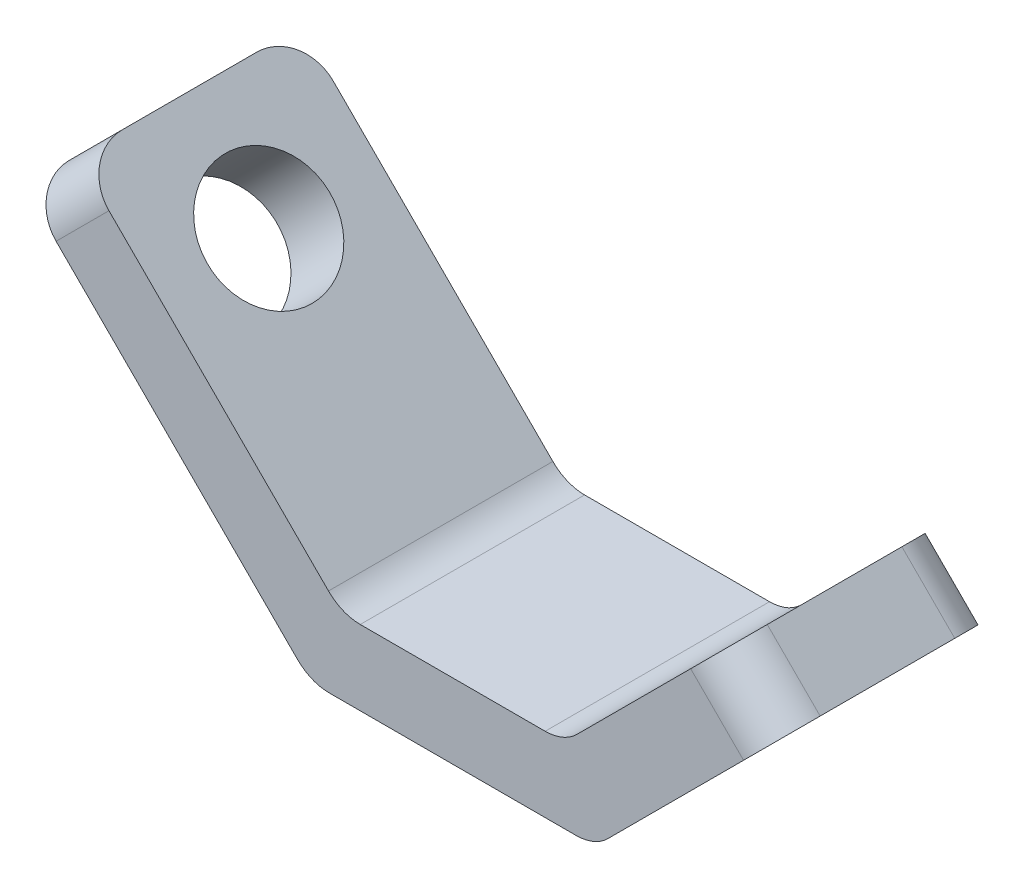
from build123d import *

# Parameters (mm, degrees)
EXTRUDE_1_DEPTH          = 7.5
CUT_EXTRUDE_1_DEPTH      = 40.184209025
CUT_EXTRUDE_1_DEPTH_BACK = 40.184209025
SKETCH_2_R               = 4.1
CUT_EXTRUDE_2_DEPTH      = 44.720704477
CUT_EXTRUDE_2_DEPTH_BACK = 44.720704477
SKETCH_3_R               = 4.1
FILLET_1_R               = 3


with BuildPart() as part:
    # ｽｹｯﾁ1 → ﾎﾞｽ - 押し出し1 (new, symmetric)
    with BuildSketch(Plane.XY):
        Polygon((0, 0), (-19.142135624, 19.142135624), (-15.606601718, 22.67766953), (2.071067812, 5), (16.920310217, 5), (27.526911935, 15.606601718), (31.062445841, 12.071067812), (18.991378029, 0), align=None)
    extrude(amount=EXTRUDE_1_DEPTH, both=True)

    # ｽｹｯﾁ2 → ｶｯﾄ - 押し出し1 (cut, two sides: drawn at the far end of the back side and taken through both)
    with BuildSketch(Plane(origin=(0, 0, 0), x_dir=(0, 0, 1), z_dir=(-0.7071067811865487, -0.7071067811865464, 0)).offset(-CUT_EXTRUDE_1_DEPTH_BACK)):
        with Locations((0, 19.571067812)):
            Circle(SKETCH_2_R)
    extrude(amount=CUT_EXTRUDE_1_DEPTH + CUT_EXTRUDE_1_DEPTH_BACK, mode=Mode.SUBTRACT)

    # ｽｹｯﾁ3 → ｶｯﾄ - 押し出し2 (cut, two sides: drawn at the far end of the back side and taken through both)
    with BuildSketch(Plane(origin=(9.495689014, -9.495689014, 0), x_dir=(0, 0, -1), z_dir=(0.707106781186549, -0.7071067811865461, 0)).offset(-CUT_EXTRUDE_2_DEPTH_BACK)):
        with Locations((0, 23)):
            Circle(SKETCH_3_R)
    extrude(amount=CUT_EXTRUDE_2_DEPTH + CUT_EXTRUDE_2_DEPTH_BACK, mode=Mode.SUBTRACT)

    # ﾌｨﾚｯﾄ1
    fillet_1_edges = [part.edges().sort_by_distance(p)[0] for p in [
        (29.294678888, 13.838834765, -7.5),
        (29.294678888, 13.838834765, 7.5),
        (-17.374368671, 20.909902577, -7.5),
        (-17.374368671, 20.909902577, 7.5),
        (18.991378029, 0, 0),
        (0, 0, 0),
        (16.920310217, 5, 0),
        (2.071067812, 5, 0),
    ]]
    fillet(fillet_1_edges, radius=FILLET_1_R)


solid = part.part
